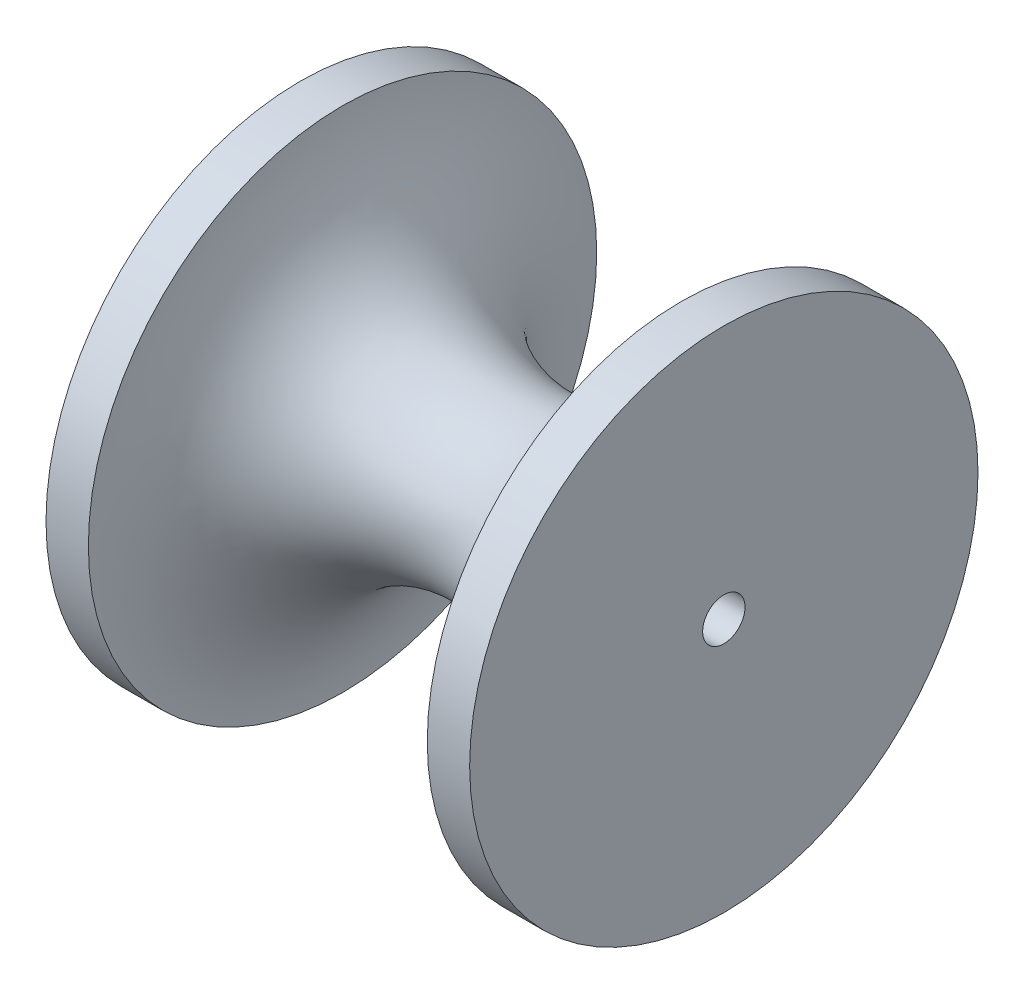
from build123d import *

# Parameters (mm, degrees)
SKETCH2_R          = 1.25
CUT_EXTRUDE1_DEPTH = 33.787192622


with BuildPart() as part:
    # Sketch1 → Revolve1 (revolve)
    with BuildSketch(Plane.XY):
        with BuildLine():
            Line((-12.5, 15), (-12.5, 0))
            Line((-12.5, 0), (12.5, 0))
            Line((12.5, 0), (12.5, 15))
            Line((12.5, 15), (10, 15))
            ThreePointArc((10, 15), (0, 5), (-10, 15))
            Line((-10, 15), (-12.5, 15))
        make_face()
    revolve(axis=Axis((-12.5, 0, 0), (1, 0, 0)))

    # Sketch2 → Cut-Extrude1 (cut, through all)
    with BuildSketch(Plane(origin=(12.5, 0, 0), x_dir=(0, 0, -1), z_dir=(1, 0, 0))):
        Circle(SKETCH2_R)
    extrude(amount=-CUT_EXTRUDE1_DEPTH, mode=Mode.SUBTRACT)


solid = part.part
